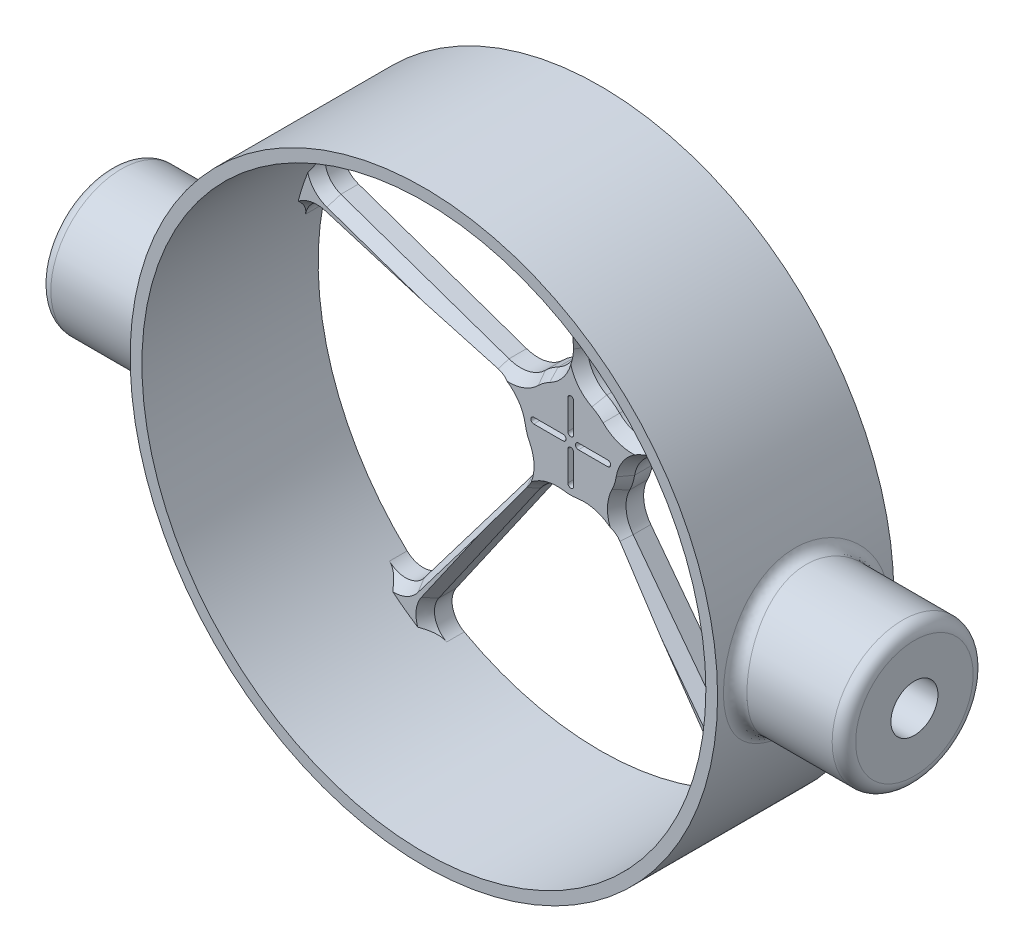
from build123d import *

# Parameters (mm, degrees)
BOSS_EXTRU_1_DEPTH    = 5
ESQUISSE1_3_R         = 50
ESQUISSE1_3_R_2       = 48
BOSS_EXTRU_2_DEPTH    = 30
CONG_1_R              = 6
CONG_2_R              = 4
CHANFREIN2_SIZE       = 1.154700538
CHANFREIN2_SIZE_2     = 2
ESQUISSE3_R           = 12
ESQUISSE3_R_2         = 4.000000000000001
BOSS_EXTRU_3_DEPTH    = 20.5
CONG_6_R              = 2
CONG_6_OF_SYM_TRIE1_R = 2


# Read off the part's stored shape, not the designer's step: Boss.-Extru.1
with BuildPart() as part:
    # Boss.-Extru.1 outline → Boss.-Extru.1 (new body)
    with BuildSketch(Plane.XY):
        with BuildLine():
            Line((45.130917035, 16.346263413), (8.278412647, 3.530989102))
            ThreePointArc((8.278412647, 3.530989102), (5.290067271, 7.281152949), (0.8, 8.964373932))
            Line((0.8, 8.964373932), (1.6, 47.973325922))
            ThreePointArc((1.6, 47.973325922), (0, 48), (-1.6, 47.973325922))
            Line((-1.6, 47.973325922), (-0.8, 8.964373932))
            ThreePointArc((-0.8, 8.964373932), (-5.290067271, 7.281152949), (-8.278412647, 3.530989102))
            Line((-8.278412647, 3.530989102), (-45.130917035, 16.346263413))
            ThreePointArc((-45.130917035, 16.346263413), (-45.650712782, 14.83281573), (-46.119771417, 13.30288256))
            Line((-46.119771417, 13.30288256), (-8.772839838, 2.009298676))
            ThreePointArc((-8.772839838, 2.009298676), (-8.559508647, -2.781152949), (-5.916340389, -6.782102653))
            Line((-5.916340389, -6.782102653), (-29.492440671, -37.870779544))
            ThreePointArc((-29.492440671, -37.870779544), (-28.21369211, -38.83281573), (-26.903586289, -39.751692351))
            Line((-26.903586289, -39.751692351), (-4.621913198, -7.722559057))
            ThreePointArc((-4.621913198, -7.722559057), (0, -9), (4.621913198, -7.722559057))
            Line((4.621913198, -7.722559057), (26.903586289, -39.751692351))
            ThreePointArc((26.903586289, -39.751692351), (28.21369211, -38.83281573), (29.492440671, -37.870779544))
            Line((29.492440671, -37.870779544), (5.916340389, -6.782102653))
            ThreePointArc((5.916340389, -6.782102653), (8.559508647, -2.781152949), (8.772839838, 2.009298676))
            Line((8.772839838, 2.009298676), (46.119771417, 13.30288256))
            ThreePointArc((46.119771417, 13.30288256), (45.650712782, 14.83281573), (45.130917035, 16.346263413))
        make_face()
        with BuildLine():
            Line((-6.3, 0.5), (-1.3, 0.5))
            ThreePointArc((-1.3, 0.5), (-0.8, 0), (-1.3, -0.5))
            Line((-1.3, -0.5), (-6.3, -0.5))
            ThreePointArc((-6.3, -0.5), (-6.8, 0), (-6.3, 0.5))
        make_face(mode=Mode.SUBTRACT)
        with BuildLine():
            Line((-0.5, -6.3), (-0.5, -1.3))
            ThreePointArc((-0.5, -1.3), (0, -0.8), (0.5, -1.3))
            Line((0.5, -1.3), (0.5, -6.3))
            ThreePointArc((0.5, -6.3), (0, -6.8), (-0.5, -6.3))
        make_face(mode=Mode.SUBTRACT)
        with BuildLine():
            Line((6.3, -0.5), (1.3, -0.5))
            ThreePointArc((1.3, -0.5), (0.8, 0), (1.3, 0.5))
            Line((1.3, 0.5), (6.3, 0.5))
            ThreePointArc((6.3, 0.5), (6.8, 0), (6.3, -0.5))
        make_face(mode=Mode.SUBTRACT)
        with BuildLine():
            Line((0.5, 6.3), (0.5, 1.3))
            ThreePointArc((0.5, 1.3), (0, 0.8), (-0.5, 1.3))
            Line((-0.5, 1.3), (-0.5, 6.3))
            ThreePointArc((-0.5, 6.3), (0, 6.8), (0.5, 6.3))
        make_face(mode=Mode.SUBTRACT)
    extrude(amount=BOSS_EXTRU_1_DEPTH)

    # Esquisse1<3> → Boss.-Extru.2 (add)
    with BuildSketch(Plane.XY):
        Circle(ESQUISSE1_3_R)
        with Locations(Location((0, 0, 0), (0, 0, 163.910213172))):
            Circle(ESQUISSE1_3_R_2, mode=Mode.SUBTRACT)
    extrude(amount=BOSS_EXTRU_2_DEPTH)

    # Congé1
    cong_1_edges = [part.edges().sort_by_distance(p)[0] for p in [
        (8.772839838, 2.0092986759999993, 2.5),
        (5.916340389, -6.782102653, 2.5),
        (4.621913198, -7.722559057, 2.5),
        (-4.621913198, -7.722559057, 2.5),
        (-5.916340389, -6.782102653000001, 2.5),
        (-8.772839838, 2.009298676, 2.5),
        (-8.278412647, 3.5309891020000004, 2.5),
        (-0.8, 8.964373932, 2.5),
        (0.8000000000000003, 8.964373932, 2.5),
        (8.278412647, 3.5309891019999995, 2.5),
    ]]
    fillet(cong_1_edges, radius=CONG_1_R)

    # Congé2
    # the kernel refuses this fillet: 4 mm, written as the material it adds along each edge
    with BuildSketch(Plane(origin=(45.130917034999996, 16.346263413000003, 0), x_dir=(-0.9445205571910896, -0.3284523055839818, 0), z_dir=(0, 0, 1))) as cong_2_piece_1:
        with BuildLine():
            CenterArc((4.238849861235651, -4), CONG_2_R, 89.99999999999997, 96.02196568515444)
            ThreePointArc((0.26092286588198993, -4.419638915779457), (0.07947801035279643, -2.2128293736304547), (0, 0))
            Line((0, 0), (4.238849861235653, 1e-17))
        make_face()
    extrude(amount=5)
    with BuildSketch(Plane(origin=(46.119771416999995, 13.30288256, 0), x_dir=(0.23253695010615014, -0.9725875625543079, 0), z_dir=(0, 0, 1))) as cong_2_piece_2:
        with BuildLine():
            CenterArc((4.242862024534811, -3.995743983845382), CONG_2_R, 87.35669191969518, 96.02196568490945)
            Line((0.24981462453140216, -4.231482104067835), (0, 0))
            ThreePointArc((0, 0), (2.2136671434293316, 0.05107219385544676), (4.427334286849374, 2e-17))
        make_face()
    extrude(amount=5)
    with BuildSketch(Plane(origin=(29.492440671000004, -37.870779544, 0), x_dir=(0.759798970234655, 0.6501580768016021, 0), z_dir=(0, 0, 1))) as cong_2_piece_3:
        with BuildLine():
            CenterArc((4.242862025003159, 3.9957439838631323), CONG_2_R, 176.62134238908993, 96.02196568570201)
            Line((0.24981462502569285, 4.231482104525024), (0, 0))
            ThreePointArc((0, 0), (2.2136671434663127, -0.05107219364245873), (4.42733428693326, -1.1e-16))
        make_face()
    extrude(amount=5)
    with BuildSketch(Plane(origin=(26.903586289000003, -39.751692351, 0), x_dir=(-0.853127869650426, -0.5217018669946714, 0), z_dir=(0, 0, 1))) as cong_2_piece_4:
        with BuildLine():
            CenterArc((4.242862024714243, -3.9957439838526088), CONG_2_R, 87.3566919219405, 96.02196568507952)
            Line((0.24981462472076882, -4.231482104243397), (0, 0))
            ThreePointArc((0, 0), (2.2136671434387365, 0.05107219376869596), (4.427334286872219, -1e-17))
        make_face()
    extrude(amount=5)
    with BuildSketch(Plane(origin=(-26.903586288999996, -39.751692351, 0), x_dir=(0.8531278696504245, -0.5217018669946735, 0), z_dir=(0, 0, 1))) as cong_2_piece_5:
        with BuildLine():
            CenterArc((4.242862024714215, 3.995743983852608), CONG_2_R, 176.6213423929801, 96.02196568507952)
            Line((0.24981462472074284, 4.231482104243388), (0, 0))
            ThreePointArc((0, 0), (2.2136671434387245, -0.05107219376869767), (4.427334286872201, 2e-17))
        make_face()
    extrude(amount=5)
    with BuildSketch(Plane(origin=(-29.492440670999997, -37.870779544, 0), x_dir=(-0.7597989702346558, 0.6501580768016011, 0), z_dir=(0, 0, 1))) as cong_2_piece_6:
        with BuildLine():
            CenterArc((4.242862025003152, -3.9957439838631297), CONG_2_R, 87.35669192520801, 96.02196568570196)
            Line((0.24981462502568552, -4.231482104525016), (0, 0))
            ThreePointArc((0, 0), (2.2136671434663, 0.05107219364245438), (4.427334286933256, -2.9e-16))
        make_face()
    extrude(amount=5)
    with BuildSketch(Plane(origin=(-46.119771416999995, 13.30288256, 0), x_dir=(-0.23253695010615077, -0.9725875625543078, 0), z_dir=(0, 0, 1))) as cong_2_piece_7:
        with BuildLine():
            CenterArc((4.242862024534798, 3.9957439838453825), CONG_2_R, 176.62134239539535, 96.0219656849095)
            Line((0.24981462453138917, 4.231482104067839), (0, 0))
            ThreePointArc((0, 0), (2.213667143429313, -0.05107219385544253), (4.427334286849361, 6e-17))
        make_face()
    extrude(amount=5)
    with BuildSketch(Plane(origin=(-45.130917034999996, 16.346263413000003, 0), x_dir=(0.3835462814348726, 0.9235216564853698, 0), z_dir=(0, 0, 1))) as cong_2_piece_8:
        with BuildLine():
            CenterArc((4.242862024809667, -3.9957439838565034), CONG_2_R, 87.35669192315036, 96.02196568515438)
            Line((0.24981462482148195, -4.231482104336827), (0, 0))
            ThreePointArc((0, 0), (2.2136671434431796, 0.0510721937219428), (4.427334286883268, 1e-17))
        make_face()
    extrude(amount=5)
    with BuildSketch(Plane(origin=(-1.6000000000000003, 47.973325922, 0), x_dir=(-0.9968436084277638, -0.07939030379533271, 0), z_dir=(0, 0, 1))) as cong_2_piece_9:
        with BuildLine():
            CenterArc((4.242862025125798, 3.9957439838700135), CONG_2_R, 176.62134238744065, 96.0219656852122)
            Line((0.2498146251551174, 4.2314821046468465), (0, 0))
            ThreePointArc((0, 0), (2.2136671434511204, -0.05107219355981621), (4.427334286906719, -3e-17))
        make_face()
    extrude(amount=5)
    with BuildSketch(Plane(origin=(1.6, 47.973325922, 0), x_dir=(0.996843608427764, -0.07939030379532973, 0), z_dir=(0, 0, 1))) as cong_2_piece_10:
        with BuildLine():
            CenterArc((4.242862025125773, -3.995743983870013), CONG_2_R, 87.356691927347, 96.02196568521236)
            Line((0.24981462515509342, -4.231482104646848), (0, 0))
            ThreePointArc((0, 0), (2.2136671434511483, 0.05107219355980466), (4.4273342869067065, 1e-17))
        make_face()
    extrude(amount=5)

    # Chanfrein2
    # the kernel refuses this chamfer: 2, 1.154700538 mm, written as the material it takes off along each edge
    with BuildSketch(Plane(origin=(3.81967524e-09, -1.34158909e-09, 5), x_dir=(0.8937392090279802, -0.4485869216172493, 0), z_dir=(-0.4485869216172493, -0.8937392090279802, 0))) as chanfrein2_piece_1:
        Polygon((8.999999996163762 - CHANFREIN2_SIZE, 0), (8.999999996163762, -CHANFREIN2_SIZE_2), (8.999999996163762, 0), align=None)
    revolve(axis=Axis((3.81967524e-09, -1.34158909e-09, 5), (0, 0, 1)), revolution_arc=17.306116791508003, mode=Mode.SUBTRACT)
    with BuildSketch(Plane(origin=(13.064134241555793, 3.306971370073433, 5), x_dir=(-0.28896627217628346, 0.9555871463349862, 0.05789386240267145), z_dir=(0.9571926036082118, 0.2894517569435929, 0))) as chanfrein2_piece_2:
        Polygon((CHANFREIN2_SIZE * 0.998322744082, -CHANFREIN2_SIZE * 0.0578938624217), (-CHANFREIN2_SIZE_2 * 0.0578938624027, -CHANFREIN2_SIZE_2 * 0.998322743754), (0, 0), align=None)
    extrude(amount=30.29509560711831, mode=Mode.SUBTRACT)
    with BuildSketch(Plane(origin=(0, -5.0909676e-10, 5), x_dir=(-0.1504509107798484, -0.9886174808516761, 0), z_dir=(-0.9886174808516761, 0.1504509107798484, 0))) as chanfrein2_piece_3:
        Polygon((8.999999999490903 - CHANFREIN2_SIZE, 0), (8.999999999490903, -CHANFREIN2_SIZE_2), (8.999999999490903, 0), align=None)
    revolve(axis=Axis((0, -5.0909676e-10, 5), (0, 0, 1)), revolution_arc=17.30611678748823, mode=Mode.SUBTRACT)
    with BuildSketch(Plane(origin=(7.182156167981002, -11.402819646752137, 5), x_dir=(0.8195218935022595, 0.5701159239721092, 0.057893862402671296), z_dir=(0.5710737610047998, -0.8208987510599787, 0))) as chanfrein2_piece_4:
        Polygon((CHANFREIN2_SIZE * 0.998322744082, -CHANFREIN2_SIZE * 0.0578938624217), (-CHANFREIN2_SIZE_2 * 0.0578938624027, -CHANFREIN2_SIZE_2 * 0.998322743754), (0, 0), align=None)
    extrude(amount=30.295095607342617, mode=Mode.SUBTRACT)
    with BuildSketch(Plane(origin=(-8.625317617171675, -10.354301479113985, 5), x_dir=(0.7954586569041727, -0.6032361277744481, 0.057893862402671074), z_dir=(-0.6042496092057569, -0.7967950864398514, 0))) as chanfrein2_piece_5:
        Polygon((CHANFREIN2_SIZE * 0.998322744082, -CHANFREIN2_SIZE * 0.0578938624217), (-CHANFREIN2_SIZE_2 * 0.0578938624027, -CHANFREIN2_SIZE_2 * 0.998322743754), (0, 0), align=None)
    extrude(amount=30.295095607319862, mode=Mode.SUBTRACT)
    with BuildSketch(Plane(origin=(-3.81968324e-09, -1.34159236e-09, 5), x_dir=(-0.9867229855455321, -0.16241228339048647, 0), z_dir=(-0.16241228339048647, 0.9867229855455321, 0))) as chanfrein2_piece_6:
        Polygon((8.999999996163755 - CHANFREIN2_SIZE, 0), (8.999999996163755, -CHANFREIN2_SIZE_2), (8.999999996163755, 0), align=None)
    revolve(axis=Axis((-3.81968324e-09, -1.34159236e-09, 5), (0, 0, 1)), revolution_arc=17.30611679150802, mode=Mode.SUBTRACT)
    with BuildSketch(Plane(origin=(-12.512895618875888, 5.003509402886749, 5), x_dir=(-0.3279014069028591, -0.9429363541868698, 0.05789386240267092), z_dir=(-0.94452055719109, 0.3284523055839811, 0))) as chanfrein2_piece_7:
        Polygon((CHANFREIN2_SIZE * 0.998322744082, -CHANFREIN2_SIZE * 0.0578938624217), (-CHANFREIN2_SIZE_2 * 0.0578938624027, -CHANFREIN2_SIZE_2 * 0.998322743754), (0, 0), align=None)
    extrude(amount=30.29509560748614, mode=Mode.SUBTRACT)
    with BuildSketch(Plane(origin=(-1.3341197e-09, 1.86099935e-09, 5), x_dir=(-0.4593774317529583, 0.8882411695007477, 0), z_dir=(0.8882411695007477, 0.4593774317529583, 0))) as chanfrein2_piece_8:
        Polygon((8.999999997623398 - CHANFREIN2_SIZE, 0), (8.999999997623398, -CHANFREIN2_SIZE_2), (8.999999997623398, 0), align=None)
    revolve(axis=Axis((-1.3341197e-09, 1.86099935e-09, 5), (0, 0, 1)), revolution_arc=17.306116788460297, mode=Mode.SUBTRACT)
    with BuildSketch(Plane(origin=(1.3341197e-09, 1.86099935e-09, 5), x_dir=(0.7028121190472122, 0.7113755163908632, 0), z_dir=(0.7113755163908632, -0.7028121190472122, 0))) as chanfrein2_piece_9:
        Polygon((8.999999997623398 - CHANFREIN2_SIZE, 0), (8.999999997623398, -CHANFREIN2_SIZE_2), (8.999999997623398, 0), align=None)
    revolve(axis=Axis((1.3341197e-09, 1.86099935e-09, 5), (0, 0, 1)), revolution_arc=17.306116788460283, mode=Mode.SUBTRACT)
    with BuildSketch(Plane(origin=(0.8919228267850058, 13.44664035305172, 5), x_dir=(0.019322702642600092, -0.0003962721715272637, -0.9998132206222079), z_dir=(0.020503801798416307, 0.9997897749586216, 0))) as chanfrein2_piece_10:
        Polygon((CHANFREIN2_SIZE_2 * 0.999813220622, CHANFREIN2_SIZE_2 * 0.0193267656127), (-CHANFREIN2_SIZE * 0.019326765619, CHANFREIN2_SIZE * 0.999813220951), (0, 0), align=None)
    extrude(amount=30.29509560749862, mode=Mode.SUBTRACT)
    with BuildSketch(Plane(origin=(13.406088135810784, -6.728803823879442, 5), x_dir=(-0.7967950864398519, -0.6042496092057561, 0), z_dir=(0.6042496092057561, -0.7967950864398519, 0))) as chanfrein2_piece_11:
        Polygon((5.999999999999999 + CHANFREIN2_SIZE, 0), (6.000000000000001, CHANFREIN2_SIZE_2), (5.999999999999999, 0), align=None)
    revolve(axis=Axis((13.406088135810784, -6.728803823879442, 5), (0, 0, -1)), revolution_arc=63.827922030814356, mode=Mode.SUBTRACT)
    with BuildSketch(Plane(origin=(14.80084478321735, -2.436184251575837, 5), x_dir=(-0.2894517569435928, 0.9571926036082118, 0), z_dir=(0.9571926036082118, 0.2894517569435928, 0))) as chanfrein2_piece_12:
        Polygon((6 + CHANFREIN2_SIZE, 0), (6, -CHANFREIN2_SIZE_2), (6, 0), align=None)
    revolve(axis=Axis((14.80084478321735, -2.436184251575837, 5), (0, 0, 1)), revolution_arc=63.82792203405886, mode=Mode.SUBTRACT)
    with BuildSketch(Plane(origin=(-2.2567636616211324, -14.829262212780936, 5), x_dir=(-0.8208987510599789, 0.5710737610047995, 0), z_dir=(-0.5710737610047995, -0.8208987510599789, 0))) as chanfrein2_piece_13:
        Polygon((6 + CHANFREIN2_SIZE, 0), (5.999999999999999, CHANFREIN2_SIZE_2), (6, 0), align=None)
    revolve(axis=Axis((-2.2567636616211324, -14.829262212780936, 5), (0, 0, -1)), revolution_arc=63.827922030817874, mode=Mode.SUBTRACT)
    with BuildSketch(Plane(origin=(2.2567636616211306, -14.829262212780936, 5), x_dir=(0.8208987510599788, 0.5710737610047996, 0), z_dir=(0.5710737610047996, -0.8208987510599788, 0))) as chanfrein2_piece_14:
        Polygon((5.999999999999999 + CHANFREIN2_SIZE, 0), (6, -CHANFREIN2_SIZE_2), (5.999999999999999, 0), align=None)
    revolve(axis=Axis((2.2567636616211306, -14.829262212780936, 5), (0, 0, 1)), revolution_arc=63.827922030817845, mode=Mode.SUBTRACT)
    with BuildSketch(Plane(origin=(-13.406088135810785, -6.728803823879442, 5), x_dir=(0.7967950864398515, -0.6042496092057567, 0), z_dir=(-0.6042496092057567, -0.7967950864398515, 0))) as chanfrein2_piece_15:
        Polygon((6 + CHANFREIN2_SIZE, 0), (6.000000000000002, -CHANFREIN2_SIZE_2), (6, 0), align=None)
    revolve(axis=Axis((-13.406088135810785, -6.728803823879442, 5), (0, 0, 1)), revolution_arc=63.82792203081435, mode=Mode.SUBTRACT)
    with BuildSketch(Plane(origin=(-14.800844783217352, -2.4361842515758387, 5), x_dir=(0.2894517569435931, 0.9571926036082118, 0), z_dir=(-0.9571926036082118, 0.2894517569435931, 0))) as chanfrein2_piece_16:
        Polygon((6.000000000000001 + CHANFREIN2_SIZE, 0), (6, CHANFREIN2_SIZE_2), (6.000000000000001, 0), align=None)
    revolve(axis=Axis((-14.800844783217352, -2.4361842515758387, 5), (0, 0, -1)), revolution_arc=63.82792203405883, mode=Mode.SUBTRACT)
    with BuildSketch(Plane(origin=(-10.542181785372001, 10.670632746033288, 5), x_dir=(-0.3284523055839814, -0.94452055719109, 0), z_dir=(-0.94452055719109, 0.3284523055839814, 0))) as chanfrein2_piece_17:
        Polygon((6 + CHANFREIN2_SIZE, 0), (6, -CHANFREIN2_SIZE_2), (6, 0), align=None)
    revolve(axis=Axis((-10.542181785372001, 10.670632746033288, 5), (0, 0, 1)), revolution_arc=63.82792203144772, mode=Mode.SUBTRACT)
    with BuildSketch(Plane(origin=(10.542181785372001, 10.670632746033286, 5), x_dir=(0.32845230558398053, -0.9445205571910903, 0), z_dir=(0.9445205571910903, 0.32845230558398053, 0))) as chanfrein2_piece_18:
        Polygon((6 + CHANFREIN2_SIZE, 0), (6, CHANFREIN2_SIZE_2), (6, 0), align=None)
    revolve(axis=Axis((10.542181785372001, 10.670632746033286, 5), (0, 0, -1)), revolution_arc=63.82792203144772, mode=Mode.SUBTRACT)
    with BuildSketch(Plane(origin=(6.890661476536736, 13.323617542261221, 5), x_dir=(-0.4593774317529576, -0.888241169500748, 0), z_dir=(0.888241169500748, -0.4593774317529576, 0))) as chanfrein2_piece_19:
        Polygon((5.999999999999999 + CHANFREIN2_SIZE, 0), (6, CHANFREIN2_SIZE_2), (5.999999999999999, 0), align=None)
    revolve(axis=Axis((6.890661476536736, 13.323617542261221, 5), (0, 0, -1)), revolution_arc=63.827922031157556, mode=Mode.SUBTRACT)
    with BuildSketch(Plane(origin=(-6.890661476536736, 13.323617542261221, 5), x_dir=(0.9997897749586215, 0.02050380179841641, 0), z_dir=(-0.02050380179841641, 0.9997897749586215, 0))) as chanfrein2_piece_20:
        Polygon((6 + CHANFREIN2_SIZE, 0), (6, CHANFREIN2_SIZE_2), (6, 0), align=None)
    revolve(axis=Axis((-6.890661476536736, 13.323617542261221, 5), (0, 0, -1)), revolution_arc=63.827922031157506, mode=Mode.SUBTRACT)
    with BuildSketch(Plane(origin=(-42.06237568229303, 12.07594002032794, 5), x_dir=(0.28896627217628346, 0.9555871463349862, 0.05789386240267116), z_dir=(0.9571926036082118, -0.2894517569435929, 0))) as chanfrein2_piece_21:
        Polygon((CHANFREIN2_SIZE * 0.998322744082, -CHANFREIN2_SIZE * 0.0578938624217), (-CHANFREIN2_SIZE_2 * 0.0578938624027, -CHANFREIN2_SIZE_2 * 0.998322743754), (0, 0), align=None)
    extrude(amount=30.295095607118274, mode=Mode.SUBTRACT)
    with BuildSketch(Plane(origin=(-24.482890356466136, -36.27202579406233, 5), x_dir=(-0.8195218935022595, 0.5701159239721093, 0.05789386240267102), z_dir=(0.5710737610047998, 0.8208987510599787, 0))) as chanfrein2_piece_22:
        Polygon((CHANFREIN2_SIZE * 0.998322744082, -CHANFREIN2_SIZE * 0.0578938624217), (-CHANFREIN2_SIZE_2 * 0.0578938624027, -CHANFREIN2_SIZE_2 * 0.998322743754), (0, 0), align=None)
    extrude(amount=30.29509560734261, mode=Mode.SUBTRACT)
    with BuildSketch(Plane(origin=(26.931117298745733, -34.493284802251964, 5), x_dir=(-0.7954586569041726, -0.603236127774448, 0.05789386240267188), z_dir=(-0.6042496092057569, 0.7967950864398514, 0))) as chanfrein2_piece_23:
        Polygon((CHANFREIN2_SIZE * 0.998322744082, -CHANFREIN2_SIZE * 0.0578938624217), (-CHANFREIN2_SIZE_2 * 0.0578938624027, -CHANFREIN2_SIZE_2 * 0.998322743754), (0, 0), align=None)
    extrude(amount=30.29509560731986, mode=Mode.SUBTRACT)
    with BuildSketch(Plane(origin=(41.127236202216004, 14.954003403052697, 5), x_dir=(0.3279014069028591, -0.9429363541868699, 0.0578938624026711), z_dir=(-0.94452055719109, -0.3284523055839811, 0))) as chanfrein2_piece_24:
        Polygon((CHANFREIN2_SIZE * 0.998322744082, -CHANFREIN2_SIZE * 0.0578938624217), (-CHANFREIN2_SIZE_2 * 0.0578938624027, -CHANFREIN2_SIZE_2 * 0.998322743754), (0, 0), align=None)
    extrude(amount=30.295095607486108, mode=Mode.SUBTRACT)
    with BuildSketch(Plane(origin=(-1.5130874625852297, 43.735367172822684, 5), x_dir=(0.998112871313678, 0.020469411668778914, 0.057893862402671116), z_dir=(0.020503801798416307, -0.9997897749586216, 0))) as chanfrein2_piece_25:
        Polygon((CHANFREIN2_SIZE * 0.998322744082, -CHANFREIN2_SIZE * 0.0578938624217), (-CHANFREIN2_SIZE_2 * 0.0578938624027, -CHANFREIN2_SIZE_2 * 0.998322743754), (0, 0), align=None)
    extrude(amount=30.295095607498613, mode=Mode.SUBTRACT)
    with BuildSketch(Plane(origin=(-43.220182710067355, 8.24716960589517, 5), x_dir=(0.28945175694352976, 0.957192603608231, 0), z_dir=(0.957192603608231, -0.28945175694352976, 0))) as chanfrein2_piece_26_section:
        Polygon((4.000000000000001 + CHANFREIN2_SIZE, 0), (3.999999999999999, -CHANFREIN2_SIZE_2), (4.000000000000001, 0), align=None)
    chanfrein2_piece_26 = revolve(axis=Axis((-43.220182710067355, 8.24716960589517, 5), (0, 0, 1)), revolution_arc=170.1704043917024, mode=Mode.PRIVATE)
    chanfrein2_piece_26 = chanfrein2_piece_26 & Plane(origin=(0, 0, 4.436626660176077), x_dir=(-0.9608285711948712, 0.2771433866712725, 0), z_dir=(0, 0, -1)) * Cylinder(48, 21, mode=Mode.PRIVATE)
    add(chanfrein2_piece_26, mode=Mode.SUBTRACT)
    with BuildSketch(Plane(origin=(-39.81342697987921, 18.732085631815906, 5), x_dir=(0.16238346175694224, 0.9867277290863127, 0), z_dir=(0.9867277290863127, -0.16238346175694224, 0))) as chanfrein2_piece_27_section:
        Polygon((3.9999999999999987 + CHANFREIN2_SIZE, 0), (3.9999999999999987, -CHANFREIN2_SIZE_2), (3.9999999999999987, 0), align=None)
    chanfrein2_piece_27 = revolve(axis=Axis((-39.81342697987921, 18.732085631815906, 5), (0, 0, 1)), revolution_arc=170.17040439194656, mode=Mode.PRIVATE)
    chanfrein2_piece_27 = chanfrein2_piece_27 & Plane(origin=(0, 0, 4.2648585532539665), x_dir=(-0.9608285711948712, 0.2771433866712725, 0), z_dir=(0, 0, -1)) * Cylinder(48, 21, mode=Mode.PRIVATE)
    add(chanfrein2_piece_27, mode=Mode.SUBTRACT)
    with BuildSketch(Plane(origin=(-21.199295352225615, -38.55632083808394, 5), x_dir=(-0.8208987510596915, 0.5710737610052128, 0), z_dir=(0.5710737610052128, 0.8208987510596915, 0))) as chanfrein2_piece_28_section:
        Polygon((4.000000000000001 + CHANFREIN2_SIZE, 0), (4.000000000000001, -CHANFREIN2_SIZE_2), (4.000000000000001, 0), align=None)
    chanfrein2_piece_28 = revolve(axis=Axis((-21.199295352225615, -38.55632083808394, 5), (0, 0, 1)), revolution_arc=170.17040439187247, mode=Mode.PRIVATE)
    chanfrein2_piece_28 = chanfrein2_piece_28 & Plane(origin=(0, 0, 4.43662666017616), x_dir=(-0.9608285711948712, 0.2771433866712725, 0), z_dir=(0, 0, -1)) * Cylinder(48, 21, mode=Mode.PRIVATE)
    add(chanfrein2_piece_28, mode=Mode.SUBTRACT)
    with BuildSketch(Plane(origin=(-30.11829764450461, -32.07628636542903, 5), x_dir=(-0.888254587275893, 0.4593514865365444, 0), z_dir=(0.4593514865365444, 0.888254587275893, 0))) as chanfrein2_piece_29_section:
        Polygon((4.000000000000005 + CHANFREIN2_SIZE, 0), (3.9999999999999996, -CHANFREIN2_SIZE_2), (4.000000000000005, 0), align=None)
    chanfrein2_piece_29 = revolve(axis=Axis((-30.11829764450461, -32.07628636542903, 5), (0, 0, 1)), revolution_arc=170.17040439249493, mode=Mode.PRIVATE)
    chanfrein2_piece_29 = chanfrein2_piece_29 & Plane(origin=(0, 0, 4.264858156632013), x_dir=(-0.9608285711948712, 0.2771433866712725, 0), z_dir=(0, 0, -1)) * Cylinder(48, 21, mode=Mode.PRIVATE)
    add(chanfrein2_piece_29, mode=Mode.SUBTRACT)
    with BuildSketch(Plane(origin=(21.199295352225615, -38.55632083808394, 5), x_dir=(-0.7113549873465242, -0.7028328976202142, 0), z_dir=(-0.7028328976202142, 0.7113549873465242, 0))) as chanfrein2_piece_30_section:
        Polygon((3.9999999999999973 + CHANFREIN2_SIZE, 0), (4, -CHANFREIN2_SIZE_2), (3.9999999999999973, 0), align=None)
    chanfrein2_piece_30 = revolve(axis=Axis((21.199295352225615, -38.55632083808394, 5), (0, 0, 1)), revolution_arc=170.1704043918724, mode=Mode.PRIVATE)
    chanfrein2_piece_30 = chanfrein2_piece_30 & Plane(origin=(0, 0, 4.264858273859648), x_dir=(-0.9608285711948712, 0.2771433866712725, 0), z_dir=(0, 0, -1)) * Cylinder(48, 21, mode=Mode.PRIVATE)
    add(chanfrein2_piece_30, mode=Mode.SUBTRACT)
    with BuildSketch(Plane(origin=(30.11829764450461, -32.07628636542903, 5), x_dir=(-0.7967950864398037, -0.6042496092058197, 0), z_dir=(-0.6042496092058197, 0.7967950864398037, 0))) as chanfrein2_piece_31_section:
        Polygon((3.999999999999998 + CHANFREIN2_SIZE, 0), (4.000000000000001, -CHANFREIN2_SIZE_2), (3.999999999999998, 0), align=None)
    chanfrein2_piece_31 = revolve(axis=Axis((30.11829764450461, -32.07628636542903, 5), (0, 0, 1)), revolution_arc=170.17040439249493, mode=Mode.PRIVATE)
    chanfrein2_piece_31 = chanfrein2_piece_31 & Plane(origin=(0, 0, 4.436626660176038), x_dir=(-0.9608285711948712, 0.2771433866712725, 0), z_dir=(0, 0, -1)) * Cylinder(48, 21, mode=Mode.PRIVATE)
    add(chanfrein2_piece_31, mode=Mode.SUBTRACT)
    with BuildSketch(Plane(origin=(39.813426979879964, 18.732085631816805, 5), x_dir=(0.32845230558402605, -0.9445205571910744, 0), z_dir=(-0.9445205571910744, -0.32845230558402605, 0))) as chanfrein2_piece_32_section:
        Polygon((4.000000000000001 + CHANFREIN2_SIZE, 0), (4.000000000000001, -CHANFREIN2_SIZE_2), (4.000000000000001, 0), align=None)
    chanfrein2_piece_32 = revolve(axis=Axis((39.813426979879964, 18.732085631816805, 5), (0, 0, 1)), revolution_arc=170.1704043919465, mode=Mode.PRIVATE)
    chanfrein2_piece_32 = chanfrein2_piece_32 & Plane(origin=(0, 0, 4.436626660176059), x_dir=(-0.9608285711948712, 0.2771433866712725, 0), z_dir=(0, 0, -1)) * Cylinder(48, 21, mode=Mode.PRIVATE)
    add(chanfrein2_piece_32, mode=Mode.SUBTRACT)
    with BuildSketch(Plane(origin=(43.220182710067355, 8.24716960589517, 5), x_dir=(0.4486130270209313, -0.8937261056873729, 0), z_dir=(-0.8937261056873729, -0.4486130270209313, 0))) as chanfrein2_piece_33_section:
        Polygon((3.999999999999993 + CHANFREIN2_SIZE, 0), (3.999999999999999, -CHANFREIN2_SIZE_2), (3.999999999999993, 0), align=None)
    chanfrein2_piece_33 = revolve(axis=Axis((43.220182710067355, 8.24716960589517, 5), (0, 0, 1)), revolution_arc=170.1704043917014, mode=Mode.PRIVATE)
    chanfrein2_piece_33 = chanfrein2_piece_33 & Plane(origin=(0, 0, 4.264858774789471), x_dir=(-0.9608285711948712, 0.2771433866712725, 0), z_dir=(0, 0, -1)) * Cylinder(48, 21, mode=Mode.PRIVATE)
    add(chanfrein2_piece_33, mode=Mode.SUBTRACT)
    with BuildSketch(Plane(origin=(5.512246562421432, 43.653351965630435, 5), x_dir=(0.9886130858434123, 0.15047978767650425, 0), z_dir=(0.15047978767650425, -0.9886130858434123, 0))) as chanfrein2_piece_34_section:
        Polygon((4.000000000000001, -CHANFREIN2_SIZE_2), (4.000000000000001 + CHANFREIN2_SIZE, 0), (4.000000000000001, 0), align=None)
    chanfrein2_piece_34 = revolve(axis=Axis((5.512246562421432, 43.653351965630435, 5), (0, 0, 1)), revolution_arc=170.17040439200454, mode=Mode.PRIVATE)
    chanfrein2_piece_34 = chanfrein2_piece_34 & Plane(origin=(0, 0, 4.264858557100143), x_dir=(-0.9608285711948712, 0.2771433866712725, 0), z_dir=(0, 0, -1)) * Cylinder(48, 21, mode=Mode.PRIVATE)
    add(chanfrein2_piece_34, mode=Mode.SUBTRACT)
    with BuildSketch(Plane(origin=(-5.512246562421432, 43.653351965630435, 5), x_dir=(0.9997897749586286, 0.020503801798076537, 0), z_dir=(0.020503801798076537, -0.9997897749586286, 0))) as chanfrein2_piece_35_section:
        Polygon((4 + CHANFREIN2_SIZE, 0), (4, -CHANFREIN2_SIZE_2), (4, 0), align=None)
    chanfrein2_piece_35 = revolve(axis=Axis((-5.512246562421432, 43.653351965630435, 5), (0, 0, 1)), revolution_arc=170.17040439200457, mode=Mode.PRIVATE)
    chanfrein2_piece_35 = chanfrein2_piece_35 & Plane(origin=(0, 0, 4.436626660176177), x_dir=(-0.9608285711948712, 0.2771433866712725, 0), z_dir=(0, 0, -1)) * Cylinder(48, 21, mode=Mode.PRIVATE)
    add(chanfrein2_piece_35, mode=Mode.SUBTRACT)

    # Esquisse3 → Boss.-Extru.3 (add)
    with BuildSketch(Plane(origin=(48, 0, 0), x_dir=(0, 0, -1), z_dir=(1, 0, 0))):
        with Locations((-15, 0)):
            Circle(ESQUISSE3_R)
        with Locations(Location((-15, 0, 0), (0, 0, 180))):
            Circle(ESQUISSE3_R_2, mode=Mode.SUBTRACT)
    boss_extru_3 = extrude(amount=BOSS_EXTRU_3_DEPTH)

    # Congé6
    cong_6_edges = [part.edges().sort_by_distance(p)[0] for p in [
        (48.538644398046394, 12, 14.999999999999998),
        (68.5, 1.47e-15, 27),
    ]]
    fillet(cong_6_edges, radius=CONG_6_R)

    # Symétrie1: Boss.-Extru.3 across plane
    add(boss_extru_3.mirror(Plane(origin=(0, 0, 0), x_dir=(0, 0, 1), z_dir=(1, 0, 0))))

    # Congé6 of Symétrie1
    cong_6_of_sym_trie1_edges = [part.edges().sort_by_distance(p)[0] for p in [
        (-48.538644398046394, 12, 14.999999999999998),
        (-68.5, 1.47e-15, 27),
    ]]
    fillet(cong_6_of_sym_trie1_edges, radius=CONG_6_OF_SYM_TRIE1_R)


solid = part.part
